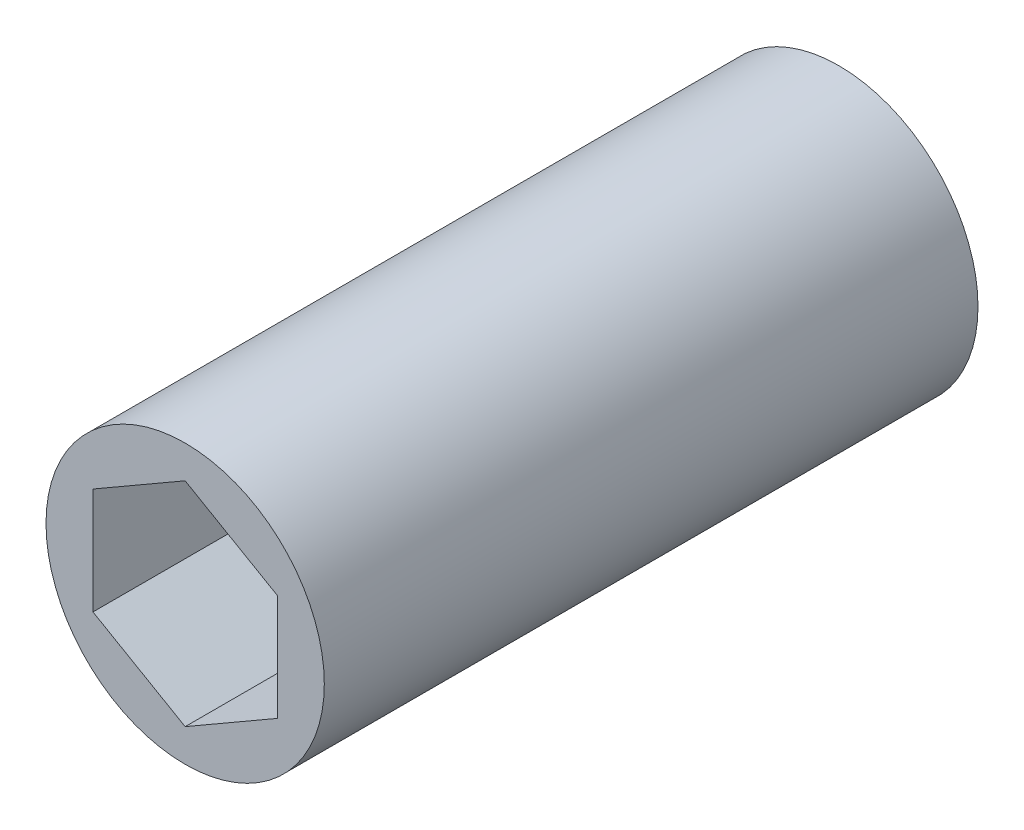
from build123d import *

# Parameters (mm, degrees)
SKETCH1_R           = 10.16
BOSS_EXTRUDE1_DEPTH = 23.8633


with BuildPart() as part:
    # Sketch1 → Boss-Extrude1 (new, symmetric)
    with BuildSketch(Plane.XY):
        Circle(SKETCH1_R)
        Polygon((0, 7.772289324), (-6.731, 3.886144662), (-6.731, -3.886144662), (0, -7.772289324), (6.731, -3.886144662), (6.731, 3.886144662), align=None, mode=Mode.SUBTRACT)
    extrude(amount=BOSS_EXTRUDE1_DEPTH, both=True)


solid = part.part
